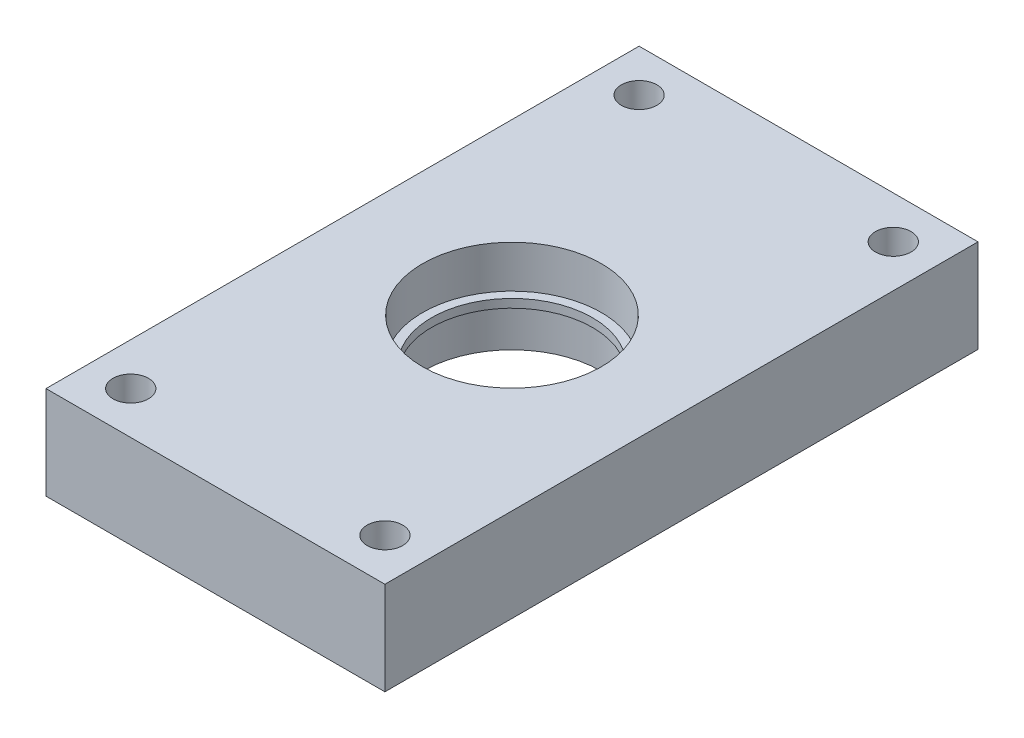
from build123d import *

# Parameters (mm, degrees)
SKETCH_1_W          = 40
SKETCH_1_H          = 70
SKETCH_1_R          = 2.1
EXTRUDE_1_DEPTH     = 11
SKETCH_2_R          = 9.5
CUT_EXTRUDE_1_DEPTH = 11
SKETCH_3_R          = 10.55
CUT_EXTRUDE_2_DEPTH = 5
CUT_EXTRUDE_START   = -5
SKETCH_4_R          = 10.55
CUT_EXTRUDE_3_DEPTH = 5


with BuildPart() as part:
    # 草图1 → 凸台-拉伸1 (new body)
    with BuildSketch(Plane(origin=(0, 0, 0), x_dir=(1, 0, 0), z_dir=(0, 1, 0))):
        Rectangle(SKETCH_1_W, SKETCH_1_H)
        with Locations((-15, -30)):
            Circle(SKETCH_1_R, mode=Mode.SUBTRACT)
        with Locations((15, -30)):
            Circle(SKETCH_1_R, mode=Mode.SUBTRACT)
        with Locations((15, 30)):
            Circle(SKETCH_1_R, mode=Mode.SUBTRACT)
        with Locations((-15, 30)):
            Circle(SKETCH_1_R, mode=Mode.SUBTRACT)
    extrude(amount=EXTRUDE_1_DEPTH)

    # 草图2 → 切除-拉伸1 (cut)
    with BuildSketch(Plane(origin=(0, 11, 0), x_dir=(1, 0, 0), z_dir=(0, 1, 0))):
        Circle(SKETCH_2_R)
    extrude(amount=-CUT_EXTRUDE_1_DEPTH, mode=Mode.SUBTRACT)

    # 草图3 → 切除-拉伸2 (cut)
    with BuildSketch(Plane(origin=(0, 11, 0), x_dir=(1, 0, 0), z_dir=(0, 1, 0))):
        Circle(SKETCH_3_R)
    extrude(amount=-CUT_EXTRUDE_2_DEPTH, mode=Mode.SUBTRACT)

    # 草图4 → 切除-拉伸3 (cut)
    with BuildSketch(Plane.XZ.offset(CUT_EXTRUDE_START)):
        Circle(SKETCH_4_R)
    extrude(amount=CUT_EXTRUDE_3_DEPTH, mode=Mode.SUBTRACT)


solid = part.part
